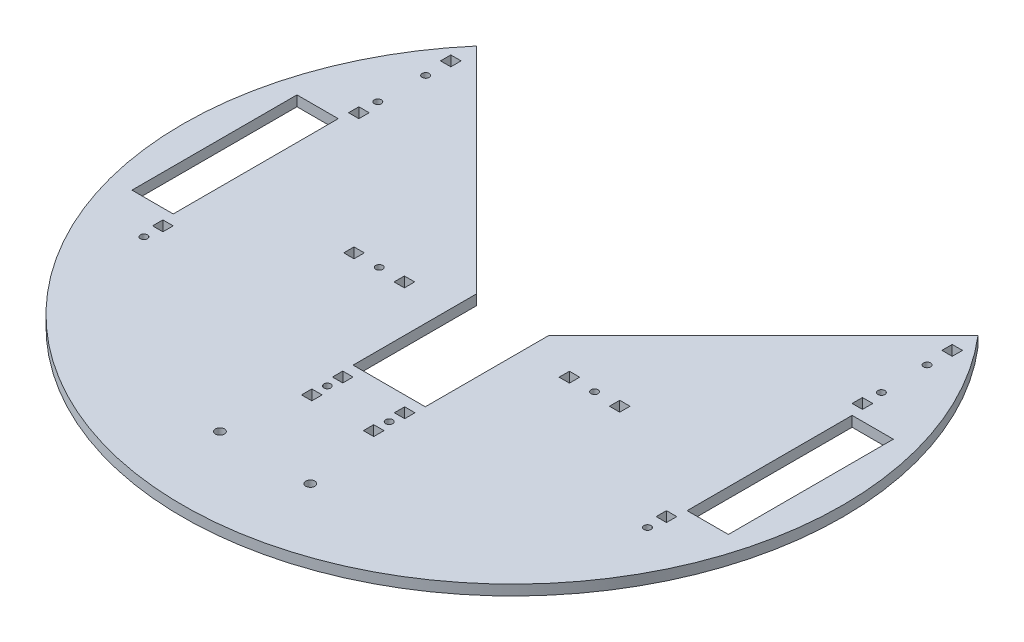
from build123d import *

# Parameters (mm, degrees)
BOTTOM_PLATE_R      = 2.159
BOTTOM_PLATE_R_2    = 2.794
BOTTOM_PLATE_W      = 25.4
BOTTOM_PLATE_H      = 101.6
BOTTOM_PLATE_W_2    = 6.35
BOTTOM_PLATE_H_2    = 6.35
BOSS_EXTRUDE1_DEPTH = 6.35


with BuildPart() as part:
    # Bottom Plate → Boss-Extrude1 (new body)
    with BuildSketch(Plane(origin=(0, 0, 0), x_dir=(1, 0, 0), z_dir=(0, 1, 0))):
        with BuildLine():
            Line((22.225, 0), (154.366234135, 132.141234135))
            ThreePointArc((154.366234135, 132.141234135), (0, -203.2), (-154.366234135, 132.141234135))
            Line((-154.366234135, 132.141234135), (-22.225, 0))
            Line((-22.225, 0), (-22.225, -76.033963608))
            Line((-22.225, -76.033963608), (22.225, -76.033963608))
            Line((22.225, -76.033963608), (22.225, 0))
        make_face()
        with Locations((155.026770144, 72.009)):
            Circle(BOTTOM_PLATE_R, mode=Mode.SUBTRACT)
        with Locations((155.026770144, -72.009)):
            Circle(BOTTOM_PLATE_R, mode=Mode.SUBTRACT)
        with Locations((154.366234135, 100.772234135)):
            Circle(BOTTOM_PLATE_R, mode=Mode.SUBTRACT)
        with Locations((66.294, -15.875)):
            Circle(BOTTOM_PLATE_R, mode=Mode.SUBTRACT)
        with Locations((-19.05, -95.083963608)):
            Circle(BOTTOM_PLATE_R, mode=Mode.SUBTRACT)
        with Locations((27.813, -152.4)):
            Circle(BOTTOM_PLATE_R_2, mode=Mode.SUBTRACT)
        with Locations((-27.813, -152.4)):
            Circle(BOTTOM_PLATE_R_2, mode=Mode.SUBTRACT)
        with Locations((19.05, -95.083963608)):
            Circle(BOTTOM_PLATE_R, mode=Mode.SUBTRACT)
        with Locations((-66.294, -15.875)):
            Circle(BOTTOM_PLATE_R, mode=Mode.SUBTRACT)
        with Locations((-155.026770144, -72.009)):
            Circle(BOTTOM_PLATE_R, mode=Mode.SUBTRACT)
        with Locations((-155.026770144, 72.009)):
            Circle(BOTTOM_PLATE_R, mode=Mode.SUBTRACT)
        with Locations((-154.366234135, 100.772234135)):
            Circle(BOTTOM_PLATE_R, mode=Mode.SUBTRACT)
        with Locations((170.901770144, 0)):
            Rectangle(BOTTOM_PLATE_W, BOTTOM_PLATE_H, mode=Mode.SUBTRACT)
        with Locations((50.8, -15.875)):
            Rectangle(BOTTOM_PLATE_W_2, BOTTOM_PLATE_H_2, mode=Mode.SUBTRACT)
        with Locations((155.026770144, -60.325)):
            Rectangle(BOTTOM_PLATE_W_2, BOTTOM_PLATE_H_2, mode=Mode.SUBTRACT)
        with Locations((155.026770144, 60.325)):
            Rectangle(BOTTOM_PLATE_W_2, BOTTOM_PLATE_H_2, mode=Mode.SUBTRACT)
        with Locations((154.366234135, 116.266234135)):
            Rectangle(BOTTOM_PLATE_W_2, BOTTOM_PLATE_H_2, mode=Mode.SUBTRACT)
        with Locations((81.788, -15.875)):
            Rectangle(BOTTOM_PLATE_W_2, BOTTOM_PLATE_H_2, mode=Mode.SUBTRACT)
        with Locations((-19.05, -85.558963608)):
            Rectangle(BOTTOM_PLATE_W_2, BOTTOM_PLATE_H_2, mode=Mode.SUBTRACT)
        with Locations((-19.05, -104.608963608)):
            Rectangle(BOTTOM_PLATE_W_2, BOTTOM_PLATE_H_2, mode=Mode.SUBTRACT)
        with Locations((19.05, -104.608963608)):
            Rectangle(BOTTOM_PLATE_W_2, BOTTOM_PLATE_H_2, mode=Mode.SUBTRACT)
        with Locations((19.05, -85.558963608)):
            Rectangle(BOTTOM_PLATE_W_2, BOTTOM_PLATE_H_2, mode=Mode.SUBTRACT)
        with Locations((-81.788, -15.875)):
            Rectangle(BOTTOM_PLATE_W_2, BOTTOM_PLATE_H_2, mode=Mode.SUBTRACT)
        with Locations((-50.8, -15.875)):
            Rectangle(BOTTOM_PLATE_W_2, BOTTOM_PLATE_H_2, mode=Mode.SUBTRACT)
        with Locations((-170.901770144, 0)):
            Rectangle(BOTTOM_PLATE_W, BOTTOM_PLATE_H, mode=Mode.SUBTRACT)
        with Locations((-155.026770144, -60.325)):
            Rectangle(BOTTOM_PLATE_W_2, BOTTOM_PLATE_H_2, mode=Mode.SUBTRACT)
        with Locations((-155.026770144, 60.325)):
            Rectangle(BOTTOM_PLATE_W_2, BOTTOM_PLATE_H_2, mode=Mode.SUBTRACT)
        with Locations((-154.366234135, 116.266234135)):
            Rectangle(BOTTOM_PLATE_W_2, BOTTOM_PLATE_H_2, mode=Mode.SUBTRACT)
    extrude(amount=-BOSS_EXTRUDE1_DEPTH)


solid = part.part
